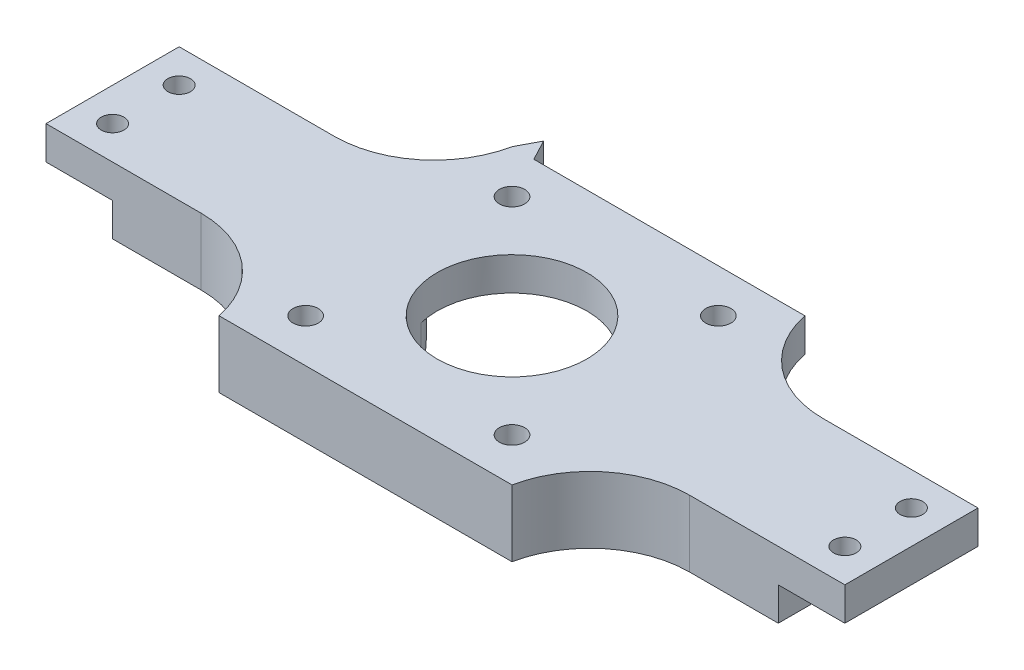
from build123d import *

# Parameters (mm, degrees)
AUFSATZ_LINEAR_AUSTRAGEN1_DEPTH      = 10
SKIZZE6_R                            = 1.9
SKIZZE6_R_2                          = 11.25
SCHNITT_LINEAR_AUSTRAGEN4_DEPTH      = 67.632124385
SKIZZE7_W                            = 20.880821379
SKIZZE7_H                            = 5
SCHNITT_LINEAR_AUSTRAGEN5_DEPTH      = 87.970339772
VERRUNDUNG3_R                        = 15
SCHNITT_LINEAR_AUSTRAGEN6_DEPTH      = 69.731361244
SCHNITT_LINEAR_AUSTRAGEN6_DEPTH_BACK = 69.731361244
SKIZZE8_W                            = 10
SKIZZE8_H                            = 5
SKIZZE9_R                            = 1.7
SCHNITT_LINEAR_AUSTRAGEN7_DEPTH      = 10
AUFSATZ_LINEAR_AUSTRAGEN2_DEPTH      = 5


with BuildPart() as part:
    # Skizze1 → Aufsatz-Linear austragen1 (new body)
    with BuildSketch(Plane(origin=(0, 0, 0), x_dir=(1, 0, 0), z_dir=(0, 1, 0))):
        Polygon((-60, -4.8), (-22, -4.8), (-22, -16.8), (22, -16.8), (22, -4.8), (60, -4.8), (60, 15.2), (22, 15.2), (22, 27.2), (0, 27.2), (-22, 27.2), (-22, 15.2), (-60, 15.2), align=None)
    extrude(amount=AUFSATZ_LINEAR_AUSTRAGEN1_DEPTH)

    # Skizze6 → Schnitt-Linear austragen4 (cut, through all)
    with BuildSketch(Plane(origin=(0, 10, 0), x_dir=(1, 0, 0), z_dir=(0, 1, 0))):
        with Locations(Location((15.5, 20.7, 0), (0, 0, 270))):
            Circle(SKIZZE6_R)
        with Locations(Location((15.5, -10.3, 0), (0, 0, 270))):
            Circle(SKIZZE6_R)
        with Locations(Location((-15.5, -10.3, 0), (0, 0, 270))):
            Circle(SKIZZE6_R)
        with Locations(Location((-15.5, 20.7, 0), (0, 0, 270))):
            Circle(SKIZZE6_R)
        with Locations(Location((0, 5.2, 0), (0, 0, 270))):
            Circle(SKIZZE6_R_2)
    extrude(amount=-SCHNITT_LINEAR_AUSTRAGEN4_DEPTH, mode=Mode.SUBTRACT)

    # Skizze7 → Schnitt-Linear austragen5 (cut, through all)
    with BuildSketch(Plane.ZY.offset(22)):
        with Locations((-25.64041069, 2.5)):
            Rectangle(SKIZZE7_W, SKIZZE7_H)
    extrude(amount=-SCHNITT_LINEAR_AUSTRAGEN5_DEPTH, mode=Mode.SUBTRACT)

    # Verrundung3
    # the kernel refuses this fillet: 15 mm, written as the material it adds along each edge
    with BuildSketch(Plane(origin=(-22, 5, -15.2), x_dir=(0, 0, -1), z_dir=(0, 1, 0))) as verrundung3_piece_1:
        with BuildLine():
            CenterArc((15, 14.696938457), VERRUNDUNG3_R, 180, 78.463040967)
            Line((0, 14.696938457), (-0.3, 14.696938457))
            Line((-0.3, 14.696938457), (-0.3, 0))
            Line((-0.3, 0), (0, -0.3))
            ThreePointArc((0, -0.3), (6, -0.3), (11.94, -0.293938769))
            Line((11.94, -0.293938769), (12, 0))
        make_face()
    extrude(amount=5)
    with BuildSketch(Plane(origin=(-22, 0, 4.8), x_dir=(-1, 0, 0), z_dir=(0, 1, 0))) as verrundung3_piece_2:
        with BuildLine():
            CenterArc((14.696938457, 15), VERRUNDUNG3_R, 191.536959033, 78.463040967)
            Line((0, 12), (-0.293938769, 11.94))
            ThreePointArc((-0.293938769, 11.94), (-0.3, 6), (-0.3, 0))
            Line((-0.3, 0), (0, -0.3))
            Line((0, -0.3), (14.696938457, -0.3))
            Line((14.696938457, -0.3), (14.696938457, 0))
        make_face()
    extrude(amount=10)
    with BuildSketch(Plane(origin=(22, 0, 4.8), x_dir=(1, 0, 0), z_dir=(0, 1, 0))) as verrundung3_piece_3:
        with BuildLine():
            CenterArc((14.696938457, -15), VERRUNDUNG3_R, 90, 78.463040967)
            Line((0, -12), (-0.293938769, -11.94))
            ThreePointArc((-0.293938769, -11.94), (-0.3, -6), (-0.3, 0))
            Line((-0.3, 0), (0, 0.3))
            Line((0, 0.3), (14.696938457, 0.3))
            Line((14.696938457, 0.3), (14.696938457, 0))
        make_face()
    extrude(amount=10)
    with BuildSketch(Plane(origin=(22, 5, -15.2), x_dir=(1, 0, 0), z_dir=(0, 1, 0))) as verrundung3_piece_4:
        with BuildLine():
            CenterArc((14.696938457, 15), VERRUNDUNG3_R, 191.536959033, 78.463040967)
            Line((0, 12), (-0.293938769, 11.94))
            ThreePointArc((-0.293938769, 11.94), (-0.3, 6), (-0.3, 0))
            Line((-0.3, 0), (0, -0.3))
            Line((0, -0.3), (14.696938457, -0.3))
            Line((14.696938457, -0.3), (14.696938457, 0))
        make_face()
    extrude(amount=5)

    # Verrundung4
    # a fillet whose section is not a circle: 17 mm, written as the material it takes off along each edge
    with BuildSketch(Plane(origin=(-5.153882032, -55.537810403, -15.2), x_dir=(-0.4098221227148323, 0, 0.912165460721633), z_dir=(0, 1, 0))) as verrundung4_piece_1:
        with BuildLine():
            Bezier((14.018959465, 0), (3.694910003, -8.223980839), (9.10424934, -20.263868965), weights=[1, 0.223796354, 1])
            Line((9.10424934, -20.263868965), (0, 0))
            ThreePointArc((0, 0), (7.009479733, -2.450585595), (14.018959465, 0))
        make_face()
    extrude(amount=60.537810403, mode=Mode.SUBTRACT)
    with BuildSketch(Plane(origin=(5.153882032, -55.537810403, -15.2), x_dir=(0.40982212271483137, 0, 0.9121654607216333), z_dir=(0, 1, 0))) as verrundung4_piece_2:
        with BuildLine():
            Bezier((14.018959465, 0), (3.694910003, 8.223980839), (9.10424934, 20.263868965), weights=[1, 0.223796354, 1])
            Line((9.10424934, 20.263868965), (0, 0))
            ThreePointArc((0, 0), (7.009479733, 2.450585595), (14.018959465, 0))
        make_face()
    extrude(amount=60.537810403, mode=Mode.SUBTRACT)

    # Skizze8 → Schnitt-Linear austragen6 (cut, two sides: drawn at the far end of the back side and taken through both)
    with BuildSketch(Plane(origin=(0, 0, -15.2), x_dir=(-1, 0, 0), z_dir=(0, 0, -1)).offset(-SCHNITT_LINEAR_AUSTRAGEN6_DEPTH_BACK)):
        with Locations((-55, 2.5)):
            Rectangle(SKIZZE8_W, SKIZZE8_H)
        with Locations((55, 2.5)):
            Rectangle(SKIZZE8_W, SKIZZE8_H)
    extrude(amount=SCHNITT_LINEAR_AUSTRAGEN6_DEPTH + SCHNITT_LINEAR_AUSTRAGEN6_DEPTH_BACK, mode=Mode.SUBTRACT)

    # Skizze9 → Schnitt-Linear austragen7 (cut)
    with BuildSketch(Plane.XZ.offset(-5)):
        with Locations(Location((-55, -0.2, 0), (0, 0, 270))):
            Circle(SKIZZE9_R)
        with Locations(Location((-55, -10.2, 0), (0, 0, 90))):
            Circle(SKIZZE9_R)
        with Locations(Location((55, -10.2, 0), (0, 0, 270))):
            Circle(SKIZZE9_R)
        with Locations(Location((55, -0.2, 0), (0, 0, 90))):
            Circle(SKIZZE9_R)
    extrude(amount=-SCHNITT_LINEAR_AUSTRAGEN7_DEPTH, mode=Mode.SUBTRACT)

    # Skizze10 → Aufsatz-Linear austragen2 (add)
    with BuildSketch(Plane(origin=(0, 10, 0), x_dir=(1, 0, 0), z_dir=(0, 1, 0))):
        Polygon((-22, 27.2), (-20.360366379, 30.307150274), (-18.720732758, 27.2), align=None)
    extrude(amount=-AUFSATZ_LINEAR_AUSTRAGEN2_DEPTH)


solid = part.part
